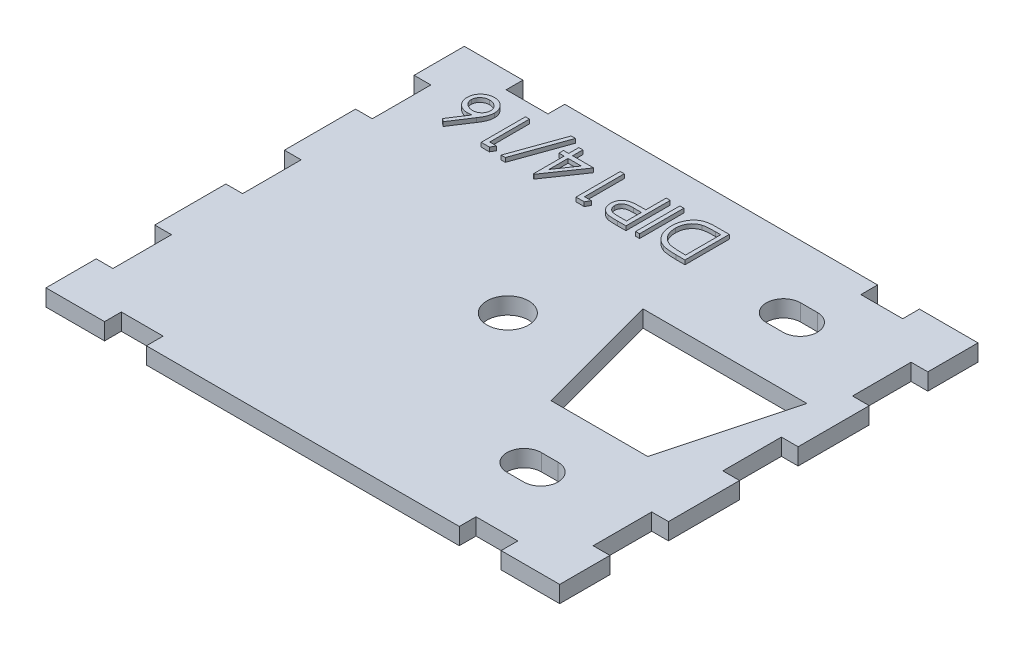
from build123d import *

# Parameters (mm, degrees)
SKETCH2_W           = 100
SKETCH2_H           = 50
BOSS_EXTRUDE1_DEPTH = 2
SKETCH12_W          = 9.8
SKETCH12_H          = 50
SKETCH12_W_2        = 8.8
CUT_EXTRUDE8_DEPTH  = 6
SKETCH13_W          = 5
SKETCH13_H          = 2
CUT_EXTRUDE10_DEPTH = 6
CUT_EXTRUDE13_DEPTH = 10
SKETCH16_R          = 2.5
CUT_EXTRUDE14_DEPTH = 10
CUT_EXTRUDE15_DEPTH = 3.5
SKETCH22_W          = 0.474893162
SKETCH22_H          = 5.291666666
BOSS_EXTRUDE4_DEPTH = 0.5


with BuildPart() as part:
    # Sketch2 → Boss-Extrude1 (new body)
    with BuildSketch(Plane(origin=(0, 0, 0), x_dir=(1, 0, 0), z_dir=(0, 1, 0))):
        Rectangle(SKETCH2_W, SKETCH2_H)
    extrude(amount=BOSS_EXTRUDE1_DEPTH)

    # Sketch12 → Cut-Extrude8 (cut)
    with BuildSketch(Plane(origin=(0, 2, 0), x_dir=(1, 0, 0), z_dir=(0, 1, 0))):
        with Locations((-45.1, 0)):
            Rectangle(SKETCH12_W, SKETCH12_H)
        with Locations((45.6, 0)):
            Rectangle(SKETCH12_W_2, SKETCH12_H)
    extrude(amount=-CUT_EXTRUDE8_DEPTH, mode=Mode.SUBTRACT)

    # Sketch13 → Cut-Extrude10 (cut)
    with BuildSketch(Plane(origin=(0, 2, 0), x_dir=(1, 0, 0), z_dir=(0, 1, 0))):
        Polygon((-28.2, 12), (-28.2, 19), (-30.2, 19), (-30.2, 25), (-40.2, 25), (-40.2, -25), (-30.2, -25), (-30.2, -19), (-28.2, -19), (-28.2, -12), (-30.2, -12), (-30.2, -3.5), (-28.2, -3.5), (-28.2, 3.5), (-30.2, 3.5), (-30.2, 12), align=None)
        with Locations((-20.7, 24)):
            Rectangle(SKETCH13_W, SKETCH13_H)
        with Locations((21.7, 24)):
            Rectangle(SKETCH13_W, SKETCH13_H)
        with Locations((-20.7, -24)):
            Rectangle(SKETCH13_W, SKETCH13_H)
        Polygon((41.2, 25), (31.2, 25), (31.2, 19), (29.2, 19), (29.2, 12), (31.2, 12), (31.2, 3.5), (29.2, 3.5), (29.2, -3.5), (31.2, -3.5), (31.2, -12), (29.2, -12), (29.2, -19), (31.2, -19), (31.2, -25), (41.2, -25), align=None)
        with Locations((21.7, -24)):
            Rectangle(SKETCH13_W, SKETCH13_H)
    extrude(amount=-CUT_EXTRUDE10_DEPTH, mode=Mode.SUBTRACT)

    # Sketch15 → Cut-Extrude13 (cut)
    with BuildSketch(Plane.XZ):
        Polygon((7.666108138, -8.5), (27.239237886, -8.5), (23.22, 6.5), (11.685346024, 6.5), align=None)
    extrude(amount=-CUT_EXTRUDE13_DEPTH, mode=Mode.SUBTRACT)

    # Sketch16 → Cut-Extrude14 (cut)
    with BuildSketch(Plane(origin=(0, 0, 0), x_dir=(-1, 0, 0), z_dir=(0, -1, 0))):
        Circle(SKETCH16_R)
    extrude(amount=-CUT_EXTRUDE14_DEPTH, mode=Mode.SUBTRACT)

    # Sketch17 → Cut-Extrude15 (cut)
    with BuildSketch(Plane(origin=(0, 0, 0), x_dir=(-1, 0, 0), z_dir=(0, -1, 0))):
        with BuildLine():
            ThreePointArc((-18.452672903, 18.55), (-20.502672903, 16.5), (-18.452672903, 14.45))
            Line((-18.452672903, 14.45), (-16.452672903, 14.45))
            ThreePointArc((-16.452672903, 14.45), (-14.402672903, 16.5), (-16.452672903, 18.55))
            Line((-16.452672903, 18.55), (-18.452672903, 18.55))
        make_face()
        with BuildLine():
            ThreePointArc((-18.452672874, -12.45), (-20.502672874, -14.5), (-18.452672874, -16.55))
            Line((-18.452672874, -16.55), (-16.452672874, -16.55))
            ThreePointArc((-16.452672874, -16.55), (-14.402672874, -14.5), (-16.452672874, -12.45))
            Line((-16.452672874, -12.45), (-18.452672874, -12.45))
        make_face()
    extrude(amount=-CUT_EXTRUDE15_DEPTH, mode=Mode.SUBTRACT)

    # Sketch22 → Boss-Extrude4 (add)
    # profile 1 of 8: a face of its own
    with BuildSketch(Plane(origin=(0, 2, 0), x_dir=(1, 0, 0), z_dir=(0, 1, 0))):
        with BuildLine():
            Line((-23.159052189, 15.434789513), (-23.524762325, 15.722057475))
            Line((-23.524762325, 15.722057475), (-22.126583573, 17.860136735))
            add(Edge.make_bspline(
                [(-22.126583573, 17.860136735), (-22.219671968, 17.845299112), (-22.401251407, 17.816356652), (-22.585047468, 17.811582139), (-22.674618762, 17.809255325)],
                knots=[0, 0, 0, 0, 1.025318673, 2, 2, 2, 2], degree=3))
            add(Edge.make_bspline(
                [(-22.674618762, 17.809255325), (-22.728400989, 17.810700875), (-22.834269702, 17.813546396), (-22.989703794, 17.8354446), (-23.139063263, 17.869953993), (-23.281729012, 17.920258484), (-23.418213242, 17.984517961), (-23.549298709, 18.061532814), (-23.672523131, 18.15527899), (-23.789466337, 18.260002963), (-23.895659433, 18.375984455), (-23.989604348, 18.499081859), (-24.068948676, 18.629285438), (-24.132162742, 18.766565912), (-24.182681976, 18.909848669), (-24.218645522, 19.059692523), (-24.240145071, 19.216350375), (-24.243047785, 19.322909838), (-24.244522275, 19.377038778)],
                knots=[0, 0, 0, 0, 1.043709831, 2.054511743, 3.041122595, 4.01515914, 4.98481438, 5.965901842, 6.960491961, 7.985277438, 9.0096037, 10.00832444, 10.987059228, 11.962929573, 12.936966118, 13.931840027, 14.949438142, 16, 16, 16, 16], degree=3))
            add(Edge.make_bspline(
                [(-24.244522275, 19.377038778), (-24.241765926, 19.451050148), (-24.236345282, 19.596601136), (-24.196736946, 19.809434264), (-24.128885773, 20.010448656), (-24.036650034, 20.20016918), (-23.919260098, 20.374622689), (-23.778459732, 20.531757593), (-23.614944089, 20.668722639), (-23.431968854, 20.786167766), (-23.233959581, 20.879491196), (-23.026333318, 20.948483673), (-22.81087333, 20.989709211), (-22.664546047, 20.99510643), (-22.590876441, 20.997823701)],
                knots=[0, 0, 0, 0, 1.0319111, 2.029359566, 3.00642934, 3.98275322, 4.962714161, 5.929339302, 6.915525103, 7.928435063, 8.953439721, 9.960121214, 10.9730072, 12, 12, 12, 12], degree=3))
            add(Edge.make_bspline(
                [(-22.590876441, 20.997823701), (-22.519667705, 20.995519771), (-22.378615665, 20.99095609), (-22.171176785, 20.950090042), (-21.97149938, 20.884324728), (-21.782151182, 20.791819753), (-21.606444215, 20.676954008), (-21.448040764, 20.539612515), (-21.310949007, 20.379706194), (-21.196443028, 20.200218944), (-21.102738703, 20.008869195), (-21.037266108, 19.807175092), (-20.99469769, 19.599316682), (-20.990317061, 19.457808761), (-20.988112018, 19.386579043)],
                knots=[0, 0, 0, 0, 1.01206923, 2.004731945, 2.994948482, 3.995280086, 4.993424783, 5.973125358, 6.967517142, 7.97830003, 8.994392566, 9.989381197, 10.98793077, 12, 12, 12, 12], degree=3))
            add(Edge.make_bspline(
                [(-20.988112018, 19.386579043), (-20.990029791, 19.332102908), (-20.993943775, 19.220922546), (-21.017301978, 19.052049679), (-21.060143777, 18.879933588), (-21.106507967, 18.734026232), (-21.152515239, 18.613188505), (-21.19517424, 18.517766145), (-21.242872201, 18.416997068), (-21.298780854, 18.312787925), (-21.358048538, 18.202161236), (-21.427279919, 18.089213843), (-21.499523929, 17.96982056), (-21.552448048, 17.890330367), (-21.579608413, 17.849536441)],
                knots=[0, 0, 0, 0, 1.17367173, 2.395347028, 3.66355231, 4.98980831, 5.690886799, 6.447442954, 7.240630024, 8.091733897, 8.994365608, 9.943299771, 10.944512865, 12, 12, 12, 12], degree=3))
            Line((-21.579608413, 17.849536441), (-23.159052189, 15.434789513))
        make_face()
        with BuildLine():
            add(Edge.make_bspline(
                [(-22.574976001, 18.351990368), (-22.534662502, 18.353170827), (-22.455567751, 18.355486877), (-22.339738422, 18.368856378), (-22.230047885, 18.393326293), (-22.126676136, 18.427770123), (-22.028097607, 18.469851587), (-21.935878135, 18.523216081), (-21.849397085, 18.585971566), (-21.770651585, 18.658202275), (-21.698324803, 18.73607743), (-21.636116736, 18.820002143), (-21.58239629, 18.907396147), (-21.538733411, 18.999085092), (-21.50472957, 19.095009054), (-21.480133793, 19.194733457), (-21.466445311, 19.298925244), (-21.464168042, 19.369580348), (-21.463005181, 19.405659572)],
                knots=[0, 0, 0, 0, 1.129540697, 2.216149546, 3.260829642, 4.271906843, 5.264942922, 6.258225651, 7.250175744, 8.252297429, 9.247108021, 10.223125336, 11.173816288, 12.116901384, 13.062424938, 14.020354563, 14.989116641, 16, 16, 16, 16], degree=3))
            add(Edge.make_bspline(
                [(-21.463005181, 19.405659572), (-21.463988153, 19.441408485), (-21.465925219, 19.511856103), (-21.482341495, 19.615289423), (-21.508766599, 19.714507411), (-21.546331833, 19.809719363), (-21.594322411, 19.900780514), (-21.651721669, 19.988791684), (-21.721323215, 20.071410118), (-21.800392034, 20.149145715), (-21.886309432, 20.22028014), (-21.976984215, 20.283878528), (-22.072741738, 20.336666449), (-22.172562209, 20.380789653), (-22.277699679, 20.413205625), (-22.386373704, 20.438039952), (-22.500081835, 20.451613295), (-22.577063515, 20.453914999), (-22.616317147, 20.455088658)],
                knots=[0, 0, 0, 0, 0.98953633, 1.950002717, 2.892353065, 3.828177645, 4.777967117, 5.738732544, 6.732276577, 7.76327951, 8.805689376, 9.818183401, 10.825652611, 11.829169732, 12.834974292, 13.867693979, 14.912718532, 16, 16, 16, 16], degree=3))
            add(Edge.make_bspline(
                [(-22.616317147, 20.455088658), (-22.655570842, 20.45391509), (-22.732552648, 20.451613565), (-22.846259864, 20.438038923), (-22.95493727, 20.413209394), (-23.060062461, 20.380775996), (-23.159928471, 20.336717419), (-23.25576977, 20.283545779), (-23.347310327, 20.220665686), (-23.433171848, 20.149022705), (-23.512570636, 20.071851092), (-23.580572843, 19.988036472), (-23.63982321, 19.901473153), (-23.685983563, 19.809357165), (-23.723969395, 19.71456403), (-23.750265041, 19.61527397), (-23.766716316, 19.511860134), (-23.768648578, 19.441409842), (-23.769629112, 19.405659572)],
                knots=[0, 0, 0, 0, 1.087095469, 2.131941252, 3.164484274, 4.170116773, 5.173462224, 6.180759088, 7.201132453, 8.243363996, 9.274190558, 10.261329848, 11.227346438, 12.172477233, 13.108141724, 14.050330866, 15.010632948, 16, 16, 16, 16], degree=3))
            add(Edge.make_bspline(
                [(-23.769629112, 19.405659572), (-23.768806819, 19.369529093), (-23.767192925, 19.298616713), (-23.748585395, 19.19482733), (-23.723452835, 19.094198131), (-23.682836289, 18.998996027), (-23.634458761, 18.906588009), (-23.572828602, 18.819616266), (-23.502169511, 18.735612541), (-23.420333972, 18.657686085), (-23.331324788, 18.586357901), (-23.236594471, 18.523583145), (-23.137888309, 18.469996661), (-23.033811125, 18.427713104), (-22.925764521, 18.393648875), (-22.813002083, 18.369020279), (-22.695443701, 18.355466061), (-22.61564337, 18.353163689), (-22.574976001, 18.351990368)],
                knots=[0, 0, 0, 0, 0.978317929, 1.920119929, 2.851929572, 3.784133089, 4.71845084, 5.67514162, 6.667477147, 7.690549442, 8.733345855, 9.756283585, 10.767808623, 11.772962645, 12.797066014, 13.836159554, 14.89727653, 16, 16, 16, 16], degree=3))
        make_face(mode=Mode.SUBTRACT)
    # profile 2 of 8: a face of its own
    with BuildSketch(Plane(origin=(0, 2, 0), x_dir=(1, 0, 0), z_dir=(0, 1, 0))):
        Polygon((-17.770922849, 15.570473274), (-18.749329967, 15.570473274), (-18.749329967, 20.86213994), (-18.274436805, 20.86213994), (-18.274436805, 16.113208316), (-17.460334241, 16.113208316), align=None)
    # profile 3 of 8: a face of its own
    with BuildSketch(Plane(origin=(0, 2, 0), x_dir=(1, 0, 0), z_dir=(0, 1, 0))):
        Polygon((-16.239180394, 15.434789513), (-14.025839048, 21.608400624), (-13.525505181, 21.608400624), (-15.738846527, 15.434789513), align=None)
    # profile 4 of 8: a face of its own
    with BuildSketch(Plane(origin=(0, 2, 0), x_dir=(1, 0, 0), z_dir=(0, 1, 0))):
        Polygon((-12.275730541, 15.434789513), (-12.372193215, 15.434789513), (-12.372193215, 19.098251051), (-12.982770138, 19.098251051), (-12.982770138, 19.640986094), (-12.372193215, 19.640986094), (-12.372193215, 20.86213994), (-11.897300053, 20.86213994), (-11.897300053, 19.640986094), (-9.38715048, 19.640986094), align=None)
        Polygon((-11.897300053, 19.098251051), (-11.897300053, 16.800107355), (-10.319976335, 19.098251051), align=None, mode=Mode.SUBTRACT)
    # profile 5 of 8: a face of its own
    with BuildSketch(Plane(origin=(0, 2, 0), x_dir=(1, 0, 0), z_dir=(0, 1, 0))):
        Polygon((-6.441328832, 15.570473274), (-7.41973595, 15.570473274), (-7.41973595, 20.86213994), (-6.944842788, 20.86213994), (-6.944842788, 16.113208316), (-6.130740223, 16.113208316), align=None)
    # profile 6 of 8: a face of its own
    with BuildSketch(Plane(origin=(0, 2, 0), x_dir=(1, 0, 0), z_dir=(0, 1, 0))):
        with BuildLine():
            Line((-1.44965048, 15.570473274), (-2.487419243, 15.570473274))
            add(Edge.make_bspline(
                [(-2.487419243, 15.570473274), (-2.558797637, 15.570551736), (-2.69556181, 15.570702073), (-2.89167862, 15.575260081), (-3.069795714, 15.581348056), (-3.229529028, 15.589787347), (-3.371370034, 15.599760763), (-3.494676903, 15.613748966), (-3.600418851, 15.628354413), (-3.663777412, 15.643203444), (-3.692672649, 15.649975477)],
                knots=[0, 0, 0, 0, 1.415646017, 2.712440637, 3.8905458, 4.950247383, 5.884950622, 6.709939814, 7.411656543, 8, 8, 8, 8], degree=3))
            add(Edge.make_bspline(
                [(-3.692672649, 15.649975477), (-3.729250735, 15.659987537), (-3.801544991, 15.679775734), (-3.905720169, 15.719404017), (-4.004818857, 15.766413516), (-4.099255577, 15.819911156), (-4.187412521, 15.882423347), (-4.272042118, 15.950342098), (-4.351369563, 16.026414205), (-4.424197036, 16.110539513), (-4.491674835, 16.199962107), (-4.54815859, 16.296962218), (-4.598035968, 16.398174872), (-4.636905862, 16.506071206), (-4.667459093, 16.619227004), (-4.689711044, 16.737936774), (-4.704012847, 16.861944432), (-4.705369909, 16.946704527), (-4.706060736, 16.989852614)],
                knots=[0, 0, 0, 0, 0.999333726, 1.975119402, 2.933498163, 3.889020618, 4.832249799, 5.779334906, 6.747801194, 7.724875447, 8.710438469, 9.696133548, 10.679360639, 11.681339199, 12.714023775, 13.766351759, 14.862936069, 16, 16, 16, 16], degree=3))
            add(Edge.make_bspline(
                [(-4.706060736, 16.989852614), (-4.705423582, 17.033361872), (-4.704176947, 17.118490673), (-4.689214706, 17.243030484), (-4.669060726, 17.362045193), (-4.638071135, 17.475270909), (-4.597483034, 17.582035229), (-4.54987005, 17.683969711), (-4.492442569, 17.779340167), (-4.426455743, 17.868492833), (-4.353050356, 17.951511391), (-4.272536986, 18.027794235), (-4.185240674, 18.096894842), (-4.091438855, 18.158968123), (-3.99021706, 18.212574641), (-3.883110471, 18.260588662), (-3.76918812, 18.300912765), (-3.690353604, 18.322124882), (-3.650271473, 18.332909839)],
                knots=[0, 0, 0, 0, 1.121902311, 2.195077645, 3.232258892, 4.234102512, 5.217864754, 6.176164875, 7.132989551, 8.084763148, 9.034132444, 9.988522005, 10.94243251, 11.903244335, 12.886203696, 13.894208494, 14.929344452, 16, 16, 16, 16], degree=3))
            add(Edge.make_bspline(
                [(-3.650271473, 18.332909839), (-3.617119055, 18.339954568), (-3.544463603, 18.355393501), (-3.424814847, 18.37274643), (-3.285437454, 18.386977728), (-3.126805647, 18.400258489), (-2.948549501, 18.407295632), (-2.751077849, 18.415558386), (-2.533722382, 18.419457128), (-2.38212372, 18.419703577), (-2.302974131, 18.419832248)],
                knots=[0, 0, 0, 0, 0.601372724, 1.317943291, 2.144091499, 3.08771165, 4.142394186, 5.309582461, 6.595334295, 8, 8, 8, 8], degree=3))
            Line((-2.302974131, 18.419832248), (-1.924543642, 18.419832248))
            Line((-1.924543642, 18.419832248), (-1.924543642, 20.86213994))
            Line((-1.924543642, 20.86213994), (-1.44965048, 20.86213994))
            Line((-1.44965048, 20.86213994), (-1.44965048, 15.570473274))
        make_face()
        with BuildLine():
            Line((-1.924543642, 16.113208316), (-1.924543642, 17.877097205))
            Line((-1.924543642, 17.877097205), (-2.851009321, 17.888757528))
            add(Edge.make_bspline(
                [(-2.851009321, 17.888757528), (-2.89624616, 17.888787356), (-2.983574947, 17.888844938), (-3.110064678, 17.88271634), (-3.227135441, 17.876049117), (-3.334960087, 17.865266634), (-3.433046475, 17.852115365), (-3.521632085, 17.834532053), (-3.601423874, 17.81659821), (-3.693335177, 17.785479811), (-3.796285476, 17.738533756), (-3.90802301, 17.66841397), (-4.003493568, 17.580080672), (-4.085411894, 17.479688961), (-4.150162735, 17.367889769), (-4.197090477, 17.248603261), (-4.225734196, 17.122282387), (-4.229334469, 17.03593638), (-4.231167574, 16.991972673)],
                knots=[0, 0, 0, 0, 1.160501667, 2.240324542, 3.248665471, 4.168823117, 5.020172044, 5.786515869, 6.485785279, 7.116517804, 8.272762037, 9.381837012, 10.485674779, 11.594342068, 12.695271952, 13.786226926, 14.872841088, 16, 16, 16, 16], degree=3))
            add(Edge.make_bspline(
                [(-4.231167574, 16.991972673), (-4.229252686, 16.949433268), (-4.225446127, 16.864870196), (-4.197327084, 16.740876728), (-4.149665756, 16.622946321), (-4.085359106, 16.512033242), (-4.005403832, 16.411908358), (-3.911831984, 16.325543685), (-3.806099397, 16.255641595), (-3.708512613, 16.209108439), (-3.621180127, 16.181820361), (-3.545689136, 16.16211975), (-3.460018409, 16.148532658), (-3.364978711, 16.135532366), (-3.260691725, 16.125038301), (-3.146494313, 16.117750887), (-3.022766861, 16.113530682), (-2.936875091, 16.113318373), (-2.892350467, 16.113208316)],
                knots=[0, 0, 0, 0, 1.12039168, 2.227199994, 3.330242575, 4.460839274, 5.593542475, 6.693949254, 7.801736126, 8.92216649, 9.528704869, 10.210659466, 10.975987387, 11.81211542, 12.738540127, 13.736887663, 14.826846554, 16, 16, 16, 16], degree=3))
            Line((-2.892350467, 16.113208316), (-1.924543642, 16.113208316))
        make_face(mode=Mode.SUBTRACT)
    # profile 7 of 8: a face of its own
    with BuildSketch(Plane(origin=(0, 2, 0), x_dir=(1, 0, 0), z_dir=(0, 1, 0))):
        with Locations((-0.058891933, 18.216306607)):
            Rectangle(SKETCH22_W, SKETCH22_H)
    # profile 8 of 8: a face of its own
    with BuildSketch(Plane(origin=(0, 2, 0), x_dir=(1, 0, 0), z_dir=(0, 1, 0))):
        with BuildLine():
            Line((5.605905076, 20.86213994), (5.605905076, 15.570473274))
            Line((5.605905076, 15.570473274), (4.53739546, 15.570473274))
            add(Edge.make_bspline(
                [(4.53739546, 15.570473274), (4.444460011, 15.571140574), (4.264909207, 15.572429795), (4.005450118, 15.580650845), (3.765726594, 15.595047052), (3.54587477, 15.616421321), (3.345541437, 15.642076434), (3.165047451, 15.674703333), (3.004100309, 15.713074776), (2.905116944, 15.745802175), (2.858308922, 15.761278562)],
                knots=[0, 0, 0, 0, 1.314317071, 2.539253741, 3.67075822, 4.709970291, 5.662644612, 6.526156501, 7.303037452, 8, 8, 8, 8], degree=3))
            add(Edge.make_bspline(
                [(2.858308922, 15.761278562), (2.797079258, 15.78460108), (2.676008415, 15.830717239), (2.503719985, 15.917841975), (2.340979611, 16.01615447), (2.189072297, 16.127908689), (2.047663322, 16.251676544), (1.914973455, 16.386456655), (1.794806005, 16.535847196), (1.68301636, 16.695212634), (1.585171417, 16.866003227), (1.49889098, 17.044798063), (1.425220585, 17.231250227), (1.36773789, 17.426720174), (1.320247249, 17.629330494), (1.288382194, 17.840615192), (1.267215519, 18.059342464), (1.265098763, 18.207774813), (1.264024734, 18.283088458)],
                knots=[0, 0, 0, 0, 0.984696416, 1.947063185, 2.89840987, 3.841051395, 4.778753227, 5.721858861, 6.681155121, 7.65838316, 8.646299769, 9.637283673, 10.641736726, 11.657050558, 12.698485921, 13.768600492, 14.86780186, 16, 16, 16, 16], degree=3))
            add(Edge.make_bspline(
                [(1.264024734, 18.283088458), (1.264976314, 18.348495109), (1.266851503, 18.477385745), (1.283668786, 18.667345988), (1.308159397, 18.851656097), (1.345902145, 19.029506784), (1.392279559, 19.202095469), (1.449521112, 19.368604968), (1.517366886, 19.529148452), (1.596048715, 19.682450768), (1.682202107, 19.828139144), (1.776080372, 19.963905237), (1.874469176, 20.091245929), (1.980956938, 20.207284453), (2.092017956, 20.315634282), (2.21142957, 20.411489008), (2.335452861, 20.499298667), (2.467813849, 20.57639663), (2.609598505, 20.644977559), (2.764510447, 20.702894566), (2.93198429, 20.752736464), (3.113129749, 20.792447078), (3.307342686, 20.824455847), (3.51514957, 20.845772044), (3.736161267, 20.860227086), (3.887925655, 20.861489941), (3.966039624, 20.86213994)],
                knots=[0, 0, 0, 0, 1.105894396, 2.179280415, 3.222964075, 4.248423888, 5.251546139, 6.243661943, 7.223682738, 8.196462441, 9.155694589, 10.083899862, 10.986397372, 11.874737962, 12.745335529, 13.607670254, 14.461432187, 15.313100333, 16.195087267, 17.121790994, 18.106827133, 19.14775296, 20.255889161, 21.433815148, 22.679170477, 24, 24, 24, 24], degree=3))
            Line((3.966039624, 20.86213994), (5.605905076, 20.86213994))
        make_face()
        with BuildLine():
            Line((5.131011913, 20.319404897), (4.523615078, 20.319404897))
            add(Edge.make_bspline(
                [(4.523615078, 20.319404897), (4.43633528, 20.319029799), (4.268464263, 20.318308348), (4.027076577, 20.311977696), (3.806520823, 20.301633338), (3.606765683, 20.287156732), (3.427923944, 20.268002993), (3.269621846, 20.246647485), (3.132378301, 20.220041815), (3.049330224, 20.195925484), (3.010953153, 20.184781166)],
                knots=[0, 0, 0, 0, 1.375205317, 2.645023457, 3.804390687, 4.853969522, 5.800190428, 6.637939096, 7.370582563, 8, 8, 8, 8], degree=3))
            add(Edge.make_bspline(
                [(3.010953153, 20.184781166), (2.962649245, 20.167771153), (2.867195169, 20.134157409), (2.729806465, 20.07281971), (2.601607188, 20.000252482), (2.480460122, 19.919112184), (2.367143839, 19.828145931), (2.262183099, 19.72706443), (2.16474884, 19.617037922), (2.076401079, 19.49769567), (1.996497537, 19.370361835), (1.927461141, 19.235178257), (1.86926424, 19.092903538), (1.821517552, 18.944032676), (1.784291508, 18.788477067), (1.758082908, 18.625846346), (1.741841746, 18.456204737), (1.739903139, 18.340720228), (1.738917896, 18.282028428)],
                knots=[0, 0, 0, 0, 0.998420628, 1.972994, 2.929372424, 3.86770908, 4.81360496, 5.759023883, 6.706048443, 7.676227424, 8.651287839, 9.634325482, 10.632389399, 11.645655052, 12.680158286, 13.74837235, 14.855672678, 16, 16, 16, 16], degree=3))
            add(Edge.make_bspline(
                [(1.738917896, 18.282028428), (1.739694765, 18.220141275), (1.74122093, 18.098563415), (1.760371555, 17.920167468), (1.788416869, 17.748614566), (1.828757867, 17.583781197), (1.880874956, 17.425881815), (1.943237279, 17.274024356), (2.018954927, 17.130163079), (2.104675311, 16.993079534), (2.20091214, 16.864849767), (2.307238512, 16.746976056), (2.422533281, 16.639238831), (2.546265088, 16.541466557), (2.680163913, 16.455397979), (2.821963925, 16.378832716), (2.973662565, 16.313778315), (3.0792147, 16.279190191), (3.132856531, 16.261612429)],
                knots=[0, 0, 0, 0, 1.122272916, 2.204715076, 3.251197285, 4.274229216, 5.279697671, 6.265416158, 7.248880903, 8.225321784, 9.195852973, 10.153576302, 11.101466393, 12.055578741, 13.010401466, 13.985536859, 14.976245305, 16, 16, 16, 16], degree=3))
            add(Edge.make_bspline(
                [(3.132856531, 16.261612429), (3.177232669, 16.249341164), (3.271588514, 16.223249085), (3.425560085, 16.194786915), (3.598847275, 16.169682494), (3.792219442, 16.148428077), (4.00545616, 16.133177008), (4.238721426, 16.121729901), (4.492116067, 16.114009159), (4.667772993, 16.113481947), (4.758941601, 16.113208316)],
                knots=[0, 0, 0, 0, 0.674548936, 1.434276114, 2.292660221, 3.240891867, 4.284742987, 5.42552168, 6.663806718, 8, 8, 8, 8], degree=3))
            Line((4.758941601, 16.113208316), (5.131011913, 16.113208316))
            Line((5.131011913, 16.113208316), (5.131011913, 20.319404897))
        make_face(mode=Mode.SUBTRACT)
    extrude(amount=BOSS_EXTRUDE4_DEPTH)


solid = part.part
